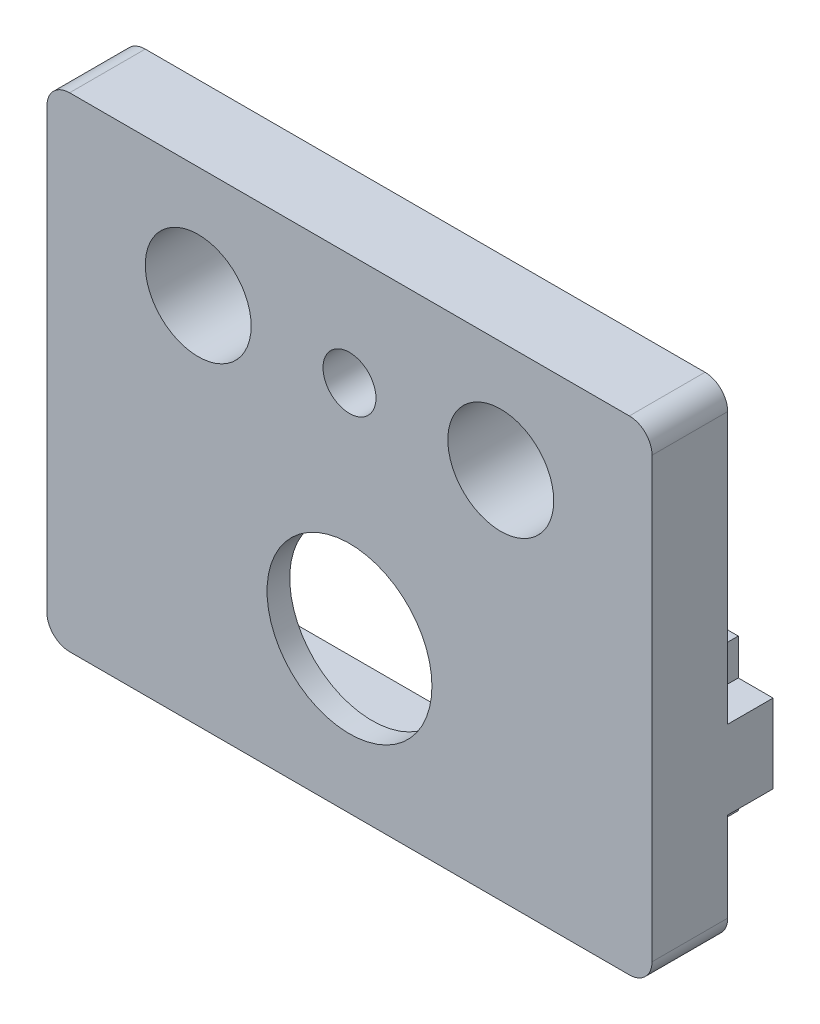
from build123d import *

# Parameters (mm, degrees)
SKETCH_1_W          = 40
SKETCH_1_H          = 20
EXTRUDE_1_DEPTH     = 3.5
SKETCH_2_W          = 40
SKETCH_2_H          = 20
SKETCH_2_R          = 5.25
EXTRUDE_2_DEPTH     = 1.5
EXTRUDE_3_DEPTH     = 8
SKETCH_4_W          = 40
SKETCH_4_H          = 12
SKETCH_4_R          = 3.5
EXTRUDE_4_DEPTH     = 5
FILLET_1_R          = 1.5
SKETCH_5_R          = 1.75
CUT_EXTRUDE_1_DEPTH = 5
CUT_EXTRUDE_2_DEPTH = 3
CUT_EXTRUDE_3_DEPTH = 3.5
CUT_EXTRUDE_START   = -3.5
SKETCH_8_R          = 5.45
SKETCH_8_R_2        = 5.25
CUT_EXTRUDE_4_DEPTH = 3.5


with BuildPart() as part:
    # 草图1 → 凸台-拉伸1 (new body)
    with BuildSketch(Plane.XY):
        Rectangle(SKETCH_1_W, SKETCH_1_H)
        with BuildLine():
            Line((-9.5, -5.75), (9.5, -5.75))
            ThreePointArc((9.5, -5.75), (11, 0), (9.5, 5.75))
            Line((9.5, 5.75), (-9.5, 5.75))
            ThreePointArc((-9.5, 5.75), (-11, 0), (-9.5, -5.75))
        make_face(mode=Mode.SUBTRACT)
    extrude(amount=EXTRUDE_1_DEPTH)

    # 草图2 → 凸台-拉伸2 (add)
    with BuildSketch(Plane.XY.offset(3.5)):
        Rectangle(SKETCH_2_W, SKETCH_2_H)
        Circle(SKETCH_2_R, mode=Mode.SUBTRACT)
    extrude(amount=EXTRUDE_2_DEPTH)

    # 草图3 → 凸台-拉伸3 (add)
    with BuildSketch(Plane.XY.offset(5)):
        Polygon((-16.560660172, 5.5), (-18.2, 5.5), (-18.2, 3.1), (-20, 3.1), (-20, -3.1), (-18.2, -3.1), (-18.2, -5.5), (-16.560660172, -5.5), (-13.9, -2.839339828), (-13.9, 2.839339828), align=None)
        Polygon((18.2, 3.1), (20, 3.1), (20, -3.1), (18.2, -3.1), (18.2, -5.5), (16.560660172, -5.5), (13.9, -2.839339828), (13.9, 2.839339828), (16.560660172, 5.5), (18.2, 5.5), align=None)
    extrude(amount=-EXTRUDE_3_DEPTH)

    # 草图4 → 凸台-拉伸4 (add)
    with BuildSketch(Plane.XY.offset(5)):
        with Locations((0, 16)):
            Rectangle(SKETCH_4_W, SKETCH_4_H)
        with Locations((-10, 14.64)):
            Circle(SKETCH_4_R, mode=Mode.SUBTRACT)
        with Locations((10, 14.64)):
            Circle(SKETCH_4_R, mode=Mode.SUBTRACT)
    extrude(amount=-EXTRUDE_4_DEPTH)

    # 圆角1
    fillet_1_edges = [part.edges().sort_by_distance(p)[0] for p in [
        (-20, 22, 2.5),
        (20, 22, 2.5),
        (20, -10, 2.5),
        (-20, -10, 2.5),
    ]]
    fillet(fillet_1_edges, radius=FILLET_1_R)

    # 草图5 → 切除-拉伸1 (cut)
    with BuildSketch(Plane.XY.offset(5)):
        with Locations((0, 14.64)):
            Circle(SKETCH_5_R)
    extrude(amount=-CUT_EXTRUDE_1_DEPTH, mode=Mode.SUBTRACT)

    # 草图6 → 切除-拉伸2 (cut)
    with BuildSketch(Plane(origin=(0, 0, -3), x_dir=(-1, 0, 0), z_dir=(0, 0, -1))):
        Polygon((-18.2, 5.5), (-18.2, 3.1), (-20, 3.1), (-20, 2.6), (-19.5, 2.6), (-17.7, 2.6), (-17.7, 5), (-16.767766953, 5), (-14.4, 2.632233047), (-14.4, -2.632233047), (-16.767766953, -5), (-17.7, -5), (-17.7, -2.6), (-19.5, -2.6), (-20, -2.6), (-20, -3.1), (-18.2, -3.1), (-18.2, -5.5), (-16.560660172, -5.5), (-13.9, -2.839339828), (-13.9, 2.839339828), (-16.560660172, 5.5), align=None)
        Polygon((18.2, -5.5), (18.2, -3.1), (20, -3.1), (20, -2.6), (19.5, -2.6), (17.7, -2.6), (17.7, -5), (16.767766953, -5), (14.4, -2.632233047), (14.4, 2.632233047), (16.767766953, 5), (17.7, 5), (17.7, 2.6), (19.5, 2.6), (20, 2.6), (20, 3.1), (18.2, 3.1), (18.2, 5.5), (16.560660172, 5.5), (13.9, 2.839339828), (13.9, -2.839339828), (16.560660172, -5.5), align=None)
    extrude(amount=-CUT_EXTRUDE_2_DEPTH, mode=Mode.SUBTRACT)

    # 草图7 → 切除-拉伸3 (cut)
    with BuildSketch(Plane(origin=(0, 0, 0), x_dir=(-1, 0, 0), z_dir=(0, 0, -1))):
        with BuildLine():
            Line((9.616579756, 5.95), (-9.616579756, 5.95))
            ThreePointArc((-9.616579756, 5.95), (-11.2, 0), (-9.616579756, -5.95))
            Line((-9.616579756, -5.95), (9.616579756, -5.95))
            ThreePointArc((9.616579756, -5.95), (11.2, 0), (9.616579756, 5.95))
        make_face()
    extrude(amount=-CUT_EXTRUDE_3_DEPTH, mode=Mode.SUBTRACT)

    # 草图8 → 切除-拉伸4 (cut)
    with BuildSketch(Plane.XY.offset(5).offset(CUT_EXTRUDE_START)):
        Circle(SKETCH_8_R)
        Circle(SKETCH_8_R_2, mode=Mode.SUBTRACT)
    extrude(amount=CUT_EXTRUDE_4_DEPTH, mode=Mode.SUBTRACT)


solid = part.part
